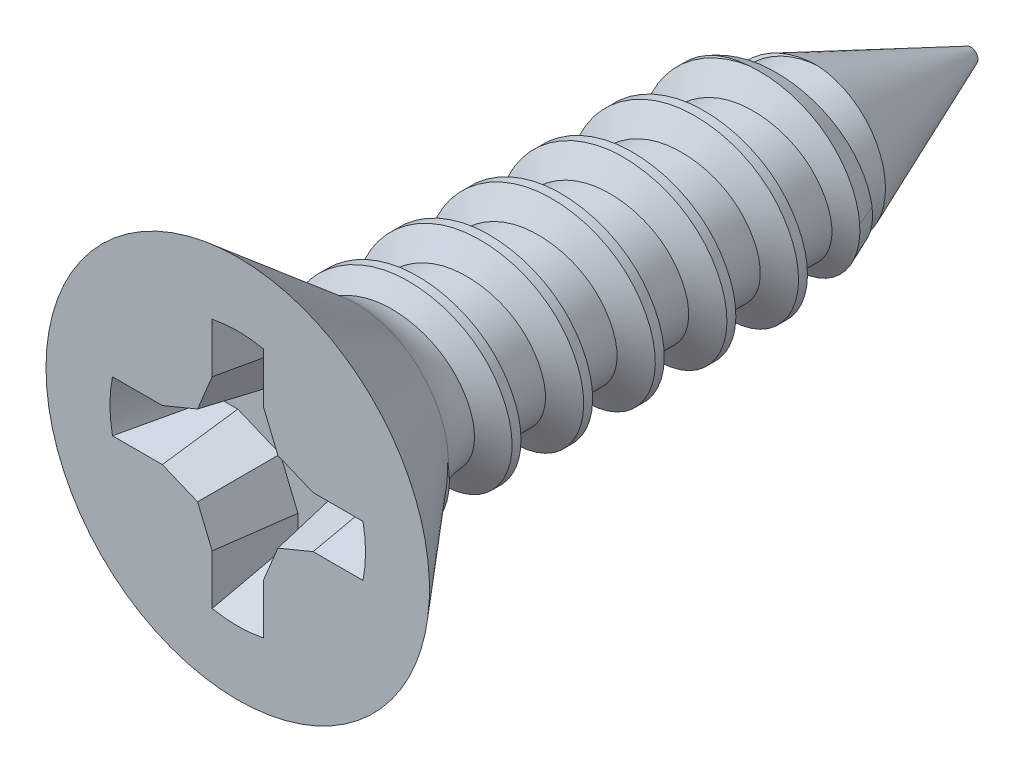
from build123d import *

# Parameters (mm, degrees)
SKETCH1_R           = 3.4
EXTRUDE3_DEPTH      = 2.1
SKETCH4_W           = 10.9
SKETCH4_H           = 1.2875
SWEEP1_PITCH        = 1.27
LPATTERN3_COUNT     = 9
LPATTERN3_PITCH     = 1.27
LPATTERN3_COL_COUNT = 2
LPATTERN3_COL_PITCH = 1.27
CUT_EXTRUDE3_DEPTH  = 1.292307692
CIRPATTERN1_COUNT   = 4
DRAFT2_ANGLE        = 10


# Read off the part's stored shape, not the designer's step: Draft1
with BuildPart() as part:
    # Sketch1 → Extrude3 (new body)
    with BuildSketch(Plane.XY):
        Circle(SKETCH1_R)
    extrude(amount=EXTRUDE3_DEPTH)

    # Sketch11 → Cut-Revolve3 (revolve, cut)
    with BuildSketch(Plane(origin=(0, 0, 0), x_dir=(0, 0, -1), z_dir=(1, 0, 0))):
        Polygon((-2.1, 3.4), (0, 1.637890775), (0, 3.4), align=None)
    revolve(axis=Axis((0, 0, 0), (0, 0, 1)), mode=Mode.SUBTRACT)


with BuildPart() as body_2:
    # Sketch4 → Revolve1 (revolve)
    with BuildSketch(Plane(origin=(0, 0, 0), x_dir=(0, 0, -1), z_dir=(1, 0, 0)), mode=Mode.PRIVATE) as revolve1_sk:
        with Locations((5.45, 0.64375)):
            Rectangle(SKETCH4_W, SKETCH4_H)
    revolve(revolve1_sk.sketch.rotate(Axis((0, 0, -10.9), (0, 0, -1)), 90), axis=Axis((0, 0, -10.9), (0, 0, -1)))

    # Sweep1: the profile of Sketch14 screwed along a right-hand helix of 1.5 turns, 6 arcs to a turn; built about Z, then put on its axis
    sweep1_z = Axis((0, 0, 0), (0, 0, 1))
    sweep1_corners = [(1.72, 0, -0.079375), (1.72, 0, 0.079375), (1.032592336, 0, 0.47625), (1.032592336, 0, -0.47625)]
    with BuildLine(mode=Mode.PRIVATE) as sweep1_profile:
        Line(sweep1_corners[0], sweep1_corners[1])
        Line(sweep1_corners[1], sweep1_corners[2])
        Line(sweep1_corners[2], sweep1_corners[3])
        Line(sweep1_corners[3], sweep1_corners[0])
    sweep1_cap = Face(sweep1_profile.wire())
    sweep1_turn_angles = [0, 30, 60, 90, 120, 150, 180, 210, 240, 270, 300, 330, 360]
    sweep1_turn_weights = [1, 0.8660254037844387, 1, 0.8660254037844387, 1, 0.8660254037844387, 1, 0.8660254037844387, 1, 0.8660254037844387, 1, 0.8660254037844387, 1]
    sweep1_turn_rails = [Edge.make_bspline([Vector(p[0], p[1], 0).rotate(sweep1_z, sweep1_turn_angles[k]) / sweep1_turn_weights[k] + Vector(0, 0, p[2] + SWEEP1_PITCH * sweep1_turn_angles[k] / 360) for k in range(13)], [0, 0, 0, 1, 1, 2, 2, 3, 3, 4, 4, 5, 5, 6, 6, 6], 2, sweep1_turn_weights) for p in sweep1_corners]
    sweep1_turn_sides = [Face.make_surface_from_curves(sweep1_turn_rails[p[0]], sweep1_turn_rails[p[1]]) for p in [(0, 1), (1, 2), (2, 3), (3, 0)]]
    sweep1_last_angles = [360, 390, 420, 450, 480, 510, 540]
    sweep1_last_weights = [1, 0.8660254037844387, 1, 0.8660254037844387, 1, 0.8660254037844332, 1]
    sweep1_last_rails = [Edge.make_bspline([Vector(p[0], p[1], 0).rotate(sweep1_z, sweep1_last_angles[k]) / sweep1_last_weights[k] + Vector(0, 0, p[2] + SWEEP1_PITCH * sweep1_last_angles[k] / 360) for k in range(7)], [0, 0, 0, 1, 1, 2, 2, 3, 3, 3], 2, sweep1_last_weights) for p in sweep1_corners]
    sweep1_last_sides = [Face.make_surface_from_curves(sweep1_last_rails[p[0]], sweep1_last_rails[p[1]]) for p in [(0, 1), (1, 2), (2, 3), (3, 0)]]
    sweep1 = Plane(origin=(0, 0, -0.79375), x_dir=(0, 1, 0), z_dir=(0, 0, -1)) * Solid(Shell([*sweep1_turn_sides, *sweep1_last_sides, sweep1_cap, sweep1_cap.rotate(sweep1_z, 540).moved(Location((0, 0, SWEEP1_PITCH * 540 / 360)))]))
    add(sweep1)

    # LPattern3: Sweep1 ×9
    with Locations(*[(0, 0, -i * LPATTERN3_PITCH) for i in range(1, LPATTERN3_COUNT)]):
        add(sweep1)


with BuildPart() as part_1:
    add(part.part)

    add(body_2.part)  # LPattern3 col merges body 2
    # LPattern3 col: Sweep1 ×2
    with Locations(*[(0, 0, i * LPATTERN3_COL_PITCH) for i in range(1, LPATTERN3_COL_COUNT)]):
        add(sweep1)

    # Sketch13 → Cut-Revolve4 (revolve, cut)
    with BuildSketch(Plane(origin=(0, 0, 0), x_dir=(0, 0, -1), z_dir=(1, 0, 0)), mode=Mode.PRIVATE) as cut_revolve4_sk:
        Polygon((10.9, 0.127), (7.054157795, 1.72), (10.9, 1.72), (15.9, 1.72), (15.9, 0.127), align=None)
    revolve(cut_revolve4_sk.sketch.rotate(Axis((0, 0, 0), (0, 0, -1)), 90), axis=Axis((0, 0, 0), (0, 0, -1)), mode=Mode.SUBTRACT)

    # Sketch12 → Cut-Extrude3 (cut)
    with BuildSketch(Plane.XY.offset(2.1)):
        with BuildLine():
            Line((2.2208707, 0.453333333), (1.337102017, 0.453333333))
            Line((1.337102017, 0.453333333), (0.712183188, 0.712183188))
            Line((0.712183188, 0.712183188), (0.453333333, 1.337102017))
            Line((0.453333333, 1.337102017), (0.453333333, 2.2208707))
            ThreePointArc((0.453333333, 2.2208707), (0.227820314, 2.255188613), (0, 2.266666667))
            Line((0, 2.266666667), (0, 0))
            Line((0, 0), (2.266666667, 0))
            ThreePointArc((2.266666667, 0), (2.255188613, 0.227820314), (2.2208707, 0.453333333))
        make_face()
    cut_extrude3 = extrude(amount=-CUT_EXTRUDE3_DEPTH, mode=Mode.SUBTRACT)

    # CirPattern1: Cut-Extrude3 ×4 about axis
    cirpattern1_axis = Axis((0, 0, 0), (0, 0, 1))
    for i in range(1, CIRPATTERN1_COUNT):
        add(cut_extrude3.rotate(cirpattern1_axis, i * 360 / CIRPATTERN1_COUNT), mode=Mode.SUBTRACT)

    # Draft1 outline → Draft1 (revolve)
    with BuildSketch(Plane.XZ):
        Polygon((2.266666667, 2.1), (1.664053638, 0.80769219), (2.266666667, 0.80769219), align=None)
    revolve(axis=Axis((0, 0, 0), (0, 0, 1)))

    # Draft2
    draft2_faces = [part_1.faces().sort_by_distance(p)[0] for p in [
        (0.453333333, 1.652332776, 1.56992611),
        (0.582758261, 1.024642602, 1.453846154),
        (1.024642602, 0.582758261, 1.453846154),
        (1.652332758, 0.453333333, 1.569926217),
        (1.652332776, -0.453333333, 1.56992611),
        (1.024642602, -0.582758261, 1.453846154),
        (0.582758261, -1.024642602, 1.453846154),
        (0.453333333, -1.652332758, 1.569926217),
        (-0.453333333, -1.652332776, 1.56992611),
        (-0.582758261, -1.024642602, 1.453846154),
        (-1.024642602, -0.582758261, 1.453846154),
        (-1.652332758, -0.453333333, 1.569926217),
        (-1.652332776, 0.453333333, 1.56992611),
        (-1.024642602, 0.582758261, 1.453846154),
        (-0.582758261, 1.024642602, 1.453846154),
        (-0.453333333, 1.652332758, 1.569926217),
    ]]
    draft(draft2_faces, Plane.XY.offset(2.1), DRAFT2_ANGLE)

    # Sketch17 → Revolve2 (revolve)
    with BuildSketch(Plane(origin=(0, 0, 0), x_dir=(0, 0, -1), z_dir=(1, 0, 0)), mode=Mode.PRIVATE) as revolve2_sk:
        with BuildLine():
            Line((0.962690741, 1.2875), (0.962690741, 0))
            Line((0.962690741, 0), (0, 0))
            Line((0, 0), (0, 1.637890775))
            ThreePointArc((0, 1.637890775), (0.450453697, 1.377821211), (0.962690741, 1.2875))
        make_face()
    revolve(revolve2_sk.sketch.rotate(Axis((0, 0, 0), (0, 0, 1)), 189.576017935), axis=Axis((0, 0, 0), (0, 0, 1)))


solid = part_1.part
